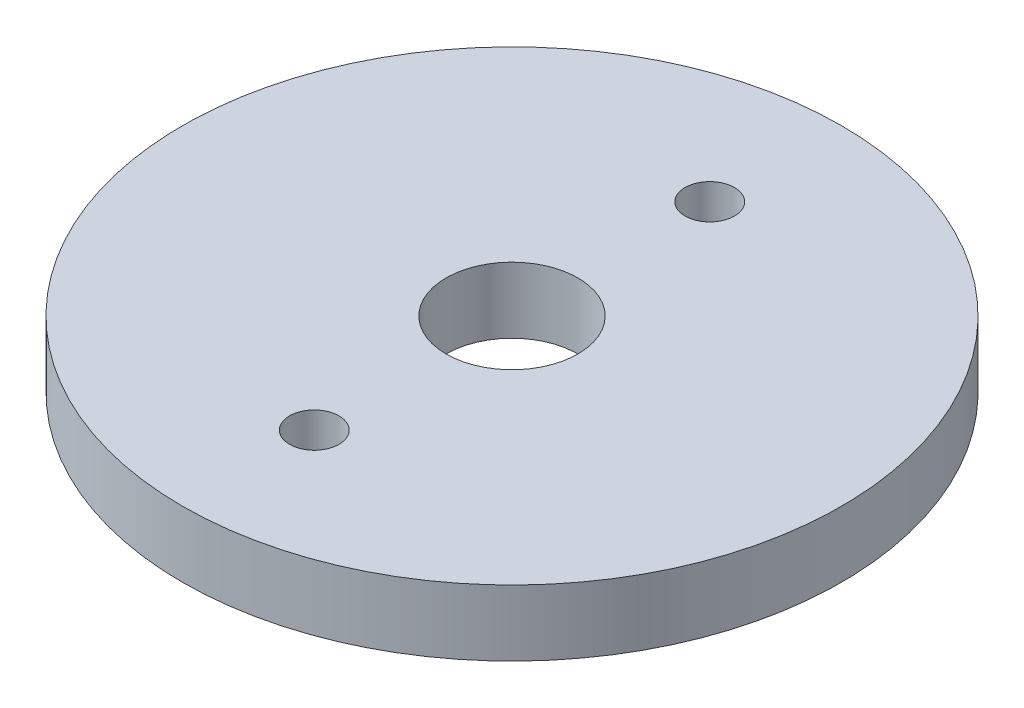
from build123d import *

# Parameters (mm, degrees)
SKETCH1_R           = 20
BOSS_EXTRUDE1_DEPTH = 4
CUT_EXTRUDE1_REACH  = 30.566
SKETCH2_R           = 4
SKETCH2_R_2         = 1.5


with BuildPart() as part:
    # Sketch1 → Boss-Extrude1 (new body)
    with BuildSketch(Plane(origin=(0, 0, 0), x_dir=(1, 0, 0), z_dir=(0, 1, 0))):
        Circle(SKETCH1_R)
    extrude(amount=BOSS_EXTRUDE1_DEPTH)

    # Sketch2 → Cut-Extrude1 (cut, up to next)
    with BuildSketch(Plane(origin=(0, 0, 0), x_dir=(1, 0, 0), z_dir=(0, 1, 0)), mode=Mode.PRIVATE) as cut_extrude1_sk1:
        Circle(SKETCH2_R)
    cut_extrude1_tool1 = extrude(cut_extrude1_sk1.sketch, amount=CUT_EXTRUDE1_REACH, mode=Mode.PRIVATE) & part.part
    # Sketch2 → Cut-Extrude1 (cut, up to next)
    with BuildSketch(Plane(origin=(0, 0, 0), x_dir=(1, 0, 0), z_dir=(0, 1, 0)), mode=Mode.PRIVATE) as cut_extrude1_sk2:
        with Locations((0, 12)):
            Circle(SKETCH2_R_2)
    cut_extrude1_tool2 = extrude(cut_extrude1_sk2.sketch, amount=CUT_EXTRUDE1_REACH, mode=Mode.PRIVATE) & part.part
    # Sketch2 → Cut-Extrude1 (cut, up to next)
    with BuildSketch(Plane(origin=(0, 0, 0), x_dir=(1, 0, 0), z_dir=(0, 1, 0)), mode=Mode.PRIVATE) as cut_extrude1_sk3:
        with Locations((0, -12)):
            Circle(SKETCH2_R_2)
    cut_extrude1_tool3 = extrude(cut_extrude1_sk3.sketch, amount=CUT_EXTRUDE1_REACH, mode=Mode.PRIVATE) & part.part
    add(cut_extrude1_tool1.solids().sort_by_distance((0, 0, 0))[0], mode=Mode.SUBTRACT)
    add(cut_extrude1_tool2.solids().sort_by_distance((0, 0, -12))[0], mode=Mode.SUBTRACT)
    add(cut_extrude1_tool3.solids().sort_by_distance((0, 0, 12))[0], mode=Mode.SUBTRACT)


solid = part.part
